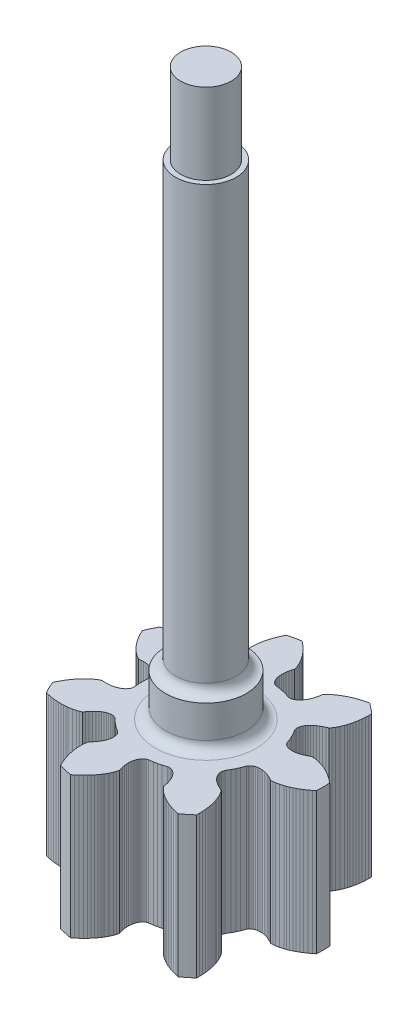
from build123d import *

# Parameters (mm, degrees)
SKETCH1_R           = 2
BOSS_EXTRUDE1_DEPTH = 2.1
SKETCH2_R           = 1.5
BOSS_EXTRUDE3_DEPTH = 25.9
BOSS_EXTRUDE4_DEPTH = 7
FILLET1_R           = 0.5
CUT_EXTRUDE3_START  = -4
SKETCH5_R           = 1.5
SKETCH5_R_2         = 1.25
CUT_EXTRUDE3_DEPTH  = 4


with BuildPart() as part:
    # Sketch1 → Boss-Extrude1 (new body)
    with BuildSketch(Plane(origin=(0, 0, 0), x_dir=(1, 0, 0), z_dir=(0, 1, 0))):
        with Locations(Location((0, 0, 0), (0, 0, 270))):
            Circle(SKETCH1_R)
    extrude(amount=BOSS_EXTRUDE1_DEPTH)

    # Sketch2 → Boss-Extrude3 (add)
    with BuildSketch(Plane(origin=(0, 2.1, 0), x_dir=(1, 0, 0), z_dir=(0, 1, 0))):
        with Locations(Location((0, 0, 0), (0, 0, 90))):
            Circle(SKETCH2_R)
    extrude(amount=BOSS_EXTRUDE3_DEPTH)

    # Sketch4 → Boss-Extrude4 (add)
    with BuildSketch(Plane.XZ):
        with BuildLine():
            Line((-1.677656104, -5.457545802), (-1.740166904, -5.314388502))
            Line((-1.740166904, -5.314388502), (-1.793915704, -5.175673402))
            Line((-1.793915704, -5.175673402), (-1.839244704, -5.042342702))
            Line((-1.839244704, -5.042342702), (-1.876421604, -4.915999102))
            Line((-1.876421604, -4.915999102), (-1.907053904, -4.793237402))
            Line((-1.907053904, -4.793237402), (-1.931099704, -4.676009702))
            Line((-1.931099704, -4.676009702), (-1.948773704, -4.566830802))
            Line((-1.948773704, -4.566830802), (-1.961024804, -4.464035702))
            Line((-1.961024804, -4.464035702), (-1.971502404, -4.279785302))
            Line((-1.971502404, -4.279785302), (-1.967365804, -4.124635702))
            Line((-1.967365804, -4.124635702), (-1.953730504, -4.000928102))
            Line((-1.953730504, -4.000928102), (-1.930260404, -3.886700602))
            Line((-1.930260404, -3.886700602), (-1.859391804, -3.809735002))
            Line((-1.859391804, -3.809735002), (-1.778417204, -3.712510502))
            Line((-1.778417204, -3.712510502), (-1.708697804, -3.615493902))
            Line((-1.708697804, -3.615493902), (-1.650076104, -3.519450202))
            Line((-1.650076104, -3.519450202), (-1.602332404, -3.425130202))
            Line((-1.602332404, -3.425130202), (-1.565200104, -3.333258302))
            Line((-1.565200104, -3.333258302), (-1.538382904, -3.244569502))
            Line((-1.538382904, -3.244569502), (-1.521548504, -3.159737902))
            Line((-1.521548504, -3.159737902), (-1.514299404, -3.079451802))
            Line((-1.514299404, -3.079451802), (-1.516222204, -3.004347502))
            Line((-1.516222204, -3.004347502), (-1.526863004, -2.935043002))
            Line((-1.526863004, -2.935043002), (-1.545721204, -2.872129302))
            Line((-1.545721204, -2.872129302), (-1.572279104, -2.816160102))
            Line((-1.572279104, -2.816160102), (-1.605971904, -2.767662302))
            Line((-1.605971904, -2.767662302), (-1.657232504, -2.718290402))
            Line((-1.657232504, -2.718290402), (-1.844744204, -2.592775302))
            Line((-1.844744204, -2.592775302), (-1.984007204, -2.487817902))
            Line((-1.984007204, -2.487817902), (-2.117322004, -2.375401802))
            Line((-2.117322004, -2.375401802), (-2.281415504, -2.220521102))
            Line((-2.281415504, -2.220521102), (-2.340956004, -2.181532002))
            Line((-2.340956004, -2.181532002), (-2.395735304, -2.159475702))
            Line((-2.395735304, -2.159475702), (-2.456210904, -2.146038102))
            Line((-2.456210904, -2.146038102), (-2.521743604, -2.141652302))
            Line((-2.521743604, -2.141652302), (-2.591678304, -2.146699902))
            Line((-2.591678304, -2.146699902), (-2.665327304, -2.161537602))
            Line((-2.665327304, -2.161537602), (-2.741987504, -2.186470302))
            Line((-2.741987504, -2.186470302), (-2.820946104, -2.221759402))
            Line((-2.820946104, -2.221759402), (-2.901443904, -2.267639402))
            Line((-2.901443904, -2.267639402), (-2.982749704, -2.324284202))
            Line((-2.982749704, -2.324284202), (-3.064080904, -2.391819002))
            Line((-3.064080904, -2.391819002), (-3.144672004, -2.470342602))
            Line((-3.144672004, -2.470342602), (-3.223742204, -2.559902302))
            Line((-3.223742204, -2.559902302), (-3.300510504, -2.660481102))
            Line((-3.300510504, -2.660481102), (-3.359776704, -2.746699402))
            Line((-3.359776704, -2.746699402), (-3.465917704, -2.794999002))
            Line((-3.465917704, -2.794999002), (-3.583489604, -2.835820002))
            Line((-3.583489604, -2.835820002), (-3.733828804, -2.874377002))
            Line((-3.733828804, -2.874377002), (-3.915791104, -2.905161502))
            Line((-3.915791104, -2.905161502), (-4.018735004, -2.916091602))
            Line((-4.018735004, -2.916091602), (-4.129109504, -2.923155402))
            Line((-4.129109504, -2.923155402), (-4.248748704, -2.925798102))
            Line((-4.248748704, -2.925798102), (-4.375248804, -2.923250802))
            Line((-4.375248804, -2.923250802), (-4.506697404, -2.915120202))
            Line((-4.506697404, -2.915120202), (-4.646771904, -2.900596502))
            Line((-4.646771904, -2.900596502), (-4.793969404, -2.879062302))
            Line((-4.793969404, -2.879062302), (-4.947447304, -2.849974302))
            Line((-4.947447304, -2.849974302), (-5.090225304, -2.816749202))
            ThreePointArc((-5.090225304, -2.816749202), (-5.241476502, -2.524161997), (-5.375926806, -2.223483907))
            Line((-5.375926806, -2.223483907), (-5.312882596, -2.091140098))
            Line((-5.312882596, -2.091140098), (-5.239932596, -1.953010098))
            Line((-5.239932596, -1.953010098), (-5.164992596, -1.824500098))
            Line((-5.164992596, -1.824500098), (-5.089012596, -1.705930098))
            Line((-5.089012596, -1.705930098), (-5.013412596, -1.598090098))
            Line((-5.013412596, -1.598090098), (-4.936532596, -1.497600098))
            Line((-4.936532596, -1.497600098), (-4.859872596, -1.405710098))
            Line((-4.859872596, -1.405710098), (-4.785532596, -1.323820098))
            Line((-4.785532596, -1.323820098), (-4.712802596, -1.250150098))
            Line((-4.712802596, -1.250150098), (-4.575282596, -1.127080098))
            Line((-4.575282596, -1.127080098), (-4.451402596, -1.033580098))
            Line((-4.451402596, -1.033580098), (-4.346182596, -0.967110098))
            Line((-4.346182596, -0.967110098), (-4.242242596, -0.914240098))
            Line((-4.242242596, -0.914240098), (-4.137882596, -0.921660098))
            Line((-4.137882596, -0.921660098), (-4.011382596, -0.924350098))
            Line((-4.011382596, -0.924350098), (-3.892062596, -0.918370098))
            Line((-3.892062596, -0.918370098), (-3.780422596, -0.904320098))
            Line((-3.780422596, -0.904320098), (-3.676912596, -0.882840098))
            Line((-3.676912596, -0.882840098), (-3.581932596, -0.854590098))
            Line((-3.581932596, -0.854590098), (-3.495872596, -0.820260098))
            Line((-3.495872596, -0.820260098), (-3.419052596, -0.780530098))
            Line((-3.419052596, -0.780530098), (-3.351762596, -0.736140098))
            Line((-3.351762596, -0.736140098), (-3.294242596, -0.687810098))
            Line((-3.294242596, -0.687810098), (-3.246692596, -0.636280098))
            Line((-3.246692596, -0.636280098), (-3.209262596, -0.582310098))
            Line((-3.209262596, -0.582310098), (-3.182062596, -0.526650098))
            Line((-3.182062596, -0.526650098), (-3.165152596, -0.470070098))
            Line((-3.165152596, -0.470070098), (-3.158512596, -0.399210098))
            Line((-3.158512596, -0.399210098), (-3.177292596, -0.174350098))
            Line((-3.177292596, -0.174350098), (-3.182062596, -3.0098e-05))
            Line((-3.182062596, -3.0098e-05), (-3.177292596, 0.174289902))
            Line((-3.177292596, 0.174289902), (-3.158512596, 0.399149902))
            Line((-3.158512596, 0.399149902), (-3.165152596, 0.470009902))
            Line((-3.165152596, 0.470009902), (-3.182062596, 0.526589902))
            Line((-3.182062596, 0.526589902), (-3.209262596, 0.582249902))
            Line((-3.209262596, 0.582249902), (-3.246692596, 0.636219902))
            Line((-3.246692596, 0.636219902), (-3.294242596, 0.687749902))
            Line((-3.294242596, 0.687749902), (-3.351762596, 0.736079902))
            Line((-3.351762596, 0.736079902), (-3.419052596, 0.780469902))
            Line((-3.419052596, 0.780469902), (-3.495872596, 0.820199902))
            Line((-3.495872596, 0.820199902), (-3.581932596, 0.854529902))
            Line((-3.581932596, 0.854529902), (-3.676912596, 0.882779902))
            Line((-3.676912596, 0.882779902), (-3.780422596, 0.904259902))
            Line((-3.780422596, 0.904259902), (-3.892062596, 0.918309902))
            Line((-3.892062596, 0.918309902), (-4.011382596, 0.924289902))
            Line((-4.011382596, 0.924289902), (-4.137882596, 0.921599902))
            Line((-4.137882596, 0.921599902), (-4.242242596, 0.914179902))
            Line((-4.242242596, 0.914179902), (-4.346182596, 0.967049902))
            Line((-4.346182596, 0.967049902), (-4.451402596, 1.033519902))
            Line((-4.451402596, 1.033519902), (-4.575282596, 1.127019902))
            Line((-4.575282596, 1.127019902), (-4.712802596, 1.250089902))
            Line((-4.712802596, 1.250089902), (-4.785532596, 1.323759902))
            Line((-4.785532596, 1.323759902), (-4.859872596, 1.405649902))
            Line((-4.859872596, 1.405649902), (-4.936532596, 1.497539902))
            Line((-4.936532596, 1.497539902), (-5.013412596, 1.598029902))
            Line((-5.013412596, 1.598029902), (-5.089012596, 1.705869902))
            Line((-5.089012596, 1.705869902), (-5.164992596, 1.824439902))
            Line((-5.164992596, 1.824439902), (-5.239932596, 1.952949902))
            Line((-5.239932596, 1.952949902), (-5.312882596, 2.091079902))
            Line((-5.312882596, 2.091079902), (-5.375926796, 2.223423702))
            ThreePointArc((-5.375926796, 2.223423702), (-5.241476491, 2.524101771), (-5.090225294, 2.816688957))
            Line((-5.090225294, 2.816688957), (-4.947447286, 2.849914054))
            Line((-4.947447286, 2.849914054), (-4.793969386, 2.879002054))
            Line((-4.793969386, 2.879002054), (-4.646771886, 2.900536254))
            Line((-4.646771886, 2.900536254), (-4.506697386, 2.915059954))
            Line((-4.506697386, 2.915059954), (-4.375248786, 2.923190554))
            Line((-4.375248786, 2.923190554), (-4.248748686, 2.925737854))
            Line((-4.248748686, 2.925737854), (-4.129109486, 2.923095154))
            Line((-4.129109486, 2.923095154), (-4.018734986, 2.916031354))
            Line((-4.018734986, 2.916031354), (-3.915791086, 2.905101254))
            Line((-3.915791086, 2.905101254), (-3.733828786, 2.874316754))
            Line((-3.733828786, 2.874316754), (-3.583489586, 2.835759754))
            Line((-3.583489586, 2.835759754), (-3.465917686, 2.794938754))
            Line((-3.465917686, 2.794938754), (-3.359776686, 2.746639154))
            Line((-3.359776686, 2.746639154), (-3.300510486, 2.660420854))
            Line((-3.300510486, 2.660420854), (-3.223742186, 2.559842054))
            Line((-3.223742186, 2.559842054), (-3.144671986, 2.470282354))
            Line((-3.144671986, 2.470282354), (-3.064080886, 2.391758754))
            Line((-3.064080886, 2.391758754), (-2.982749686, 2.324223954))
            Line((-2.982749686, 2.324223954), (-2.901443886, 2.267579154))
            Line((-2.901443886, 2.267579154), (-2.820946086, 2.221699154))
            Line((-2.820946086, 2.221699154), (-2.741987486, 2.186410054))
            Line((-2.741987486, 2.186410054), (-2.665327286, 2.161477354))
            Line((-2.665327286, 2.161477354), (-2.591678286, 2.146639654))
            Line((-2.591678286, 2.146639654), (-2.521743586, 2.141592054))
            Line((-2.521743586, 2.141592054), (-2.456210886, 2.145977854))
            Line((-2.456210886, 2.145977854), (-2.395735286, 2.159415454))
            Line((-2.395735286, 2.159415454), (-2.340955986, 2.181471754))
            Line((-2.340955986, 2.181471754), (-2.281415486, 2.220460854))
            Line((-2.281415486, 2.220460854), (-2.117321986, 2.375341554))
            Line((-2.117321986, 2.375341554), (-1.984007186, 2.487757654))
            Line((-1.984007186, 2.487757654), (-1.844744186, 2.592715054))
            Line((-1.844744186, 2.592715054), (-1.657232486, 2.718230154))
            Line((-1.657232486, 2.718230154), (-1.605971886, 2.767602054))
            Line((-1.605971886, 2.767602054), (-1.572279086, 2.816099854))
            Line((-1.572279086, 2.816099854), (-1.545721186, 2.872069054))
            Line((-1.545721186, 2.872069054), (-1.526862986, 2.934982754))
            Line((-1.526862986, 2.934982754), (-1.516222186, 3.004287254))
            Line((-1.516222186, 3.004287254), (-1.514299386, 3.079391554))
            Line((-1.514299386, 3.079391554), (-1.521548486, 3.159677654))
            Line((-1.521548486, 3.159677654), (-1.538382886, 3.244509254))
            Line((-1.538382886, 3.244509254), (-1.565200086, 3.333198054))
            Line((-1.565200086, 3.333198054), (-1.602332386, 3.425069954))
            Line((-1.602332386, 3.425069954), (-1.650076086, 3.519389954))
            Line((-1.650076086, 3.519389954), (-1.708697786, 3.615433654))
            Line((-1.708697786, 3.615433654), (-1.778417186, 3.712450254))
            Line((-1.778417186, 3.712450254), (-1.859391786, 3.809674754))
            Line((-1.859391786, 3.809674754), (-1.930260386, 3.886640354))
            Line((-1.930260386, 3.886640354), (-1.953730486, 4.000867854))
            Line((-1.953730486, 4.000867854), (-1.967365786, 4.124575454))
            Line((-1.967365786, 4.124575454), (-1.971502386, 4.279725054))
            Line((-1.971502386, 4.279725054), (-1.961024786, 4.463975454))
            Line((-1.961024786, 4.463975454), (-1.948773686, 4.566770554))
            Line((-1.948773686, 4.566770554), (-1.931099686, 4.675949454))
            Line((-1.931099686, 4.675949454), (-1.907053886, 4.793177154))
            Line((-1.907053886, 4.793177154), (-1.876421586, 4.915938854))
            Line((-1.876421586, 4.915938854), (-1.839244686, 5.042282454))
            Line((-1.839244686, 5.042282454), (-1.793915686, 5.175613154))
            Line((-1.793915686, 5.175613154), (-1.740166886, 5.314328254))
            Line((-1.740166886, 5.314328254), (-1.677656086, 5.457485554))
            Line((-1.677656086, 5.457485554), (-1.613492886, 5.589290554))
            ThreePointArc((-1.613492886, 5.589290554), (-1.294584924, 5.671642777), (-0.971527485, 5.735814951))
            Line((-0.971527485, 5.735814951), (-0.856530379, 5.644902123))
            Line((-0.856530379, 5.644902123), (-0.738096579, 5.543044323))
            Line((-0.738096579, 5.543044323), (-0.629484279, 5.441387023))
            Line((-0.629484279, 5.441387023), (-0.530794179, 5.340927723))
            Line((-0.530794179, 5.340927723), (-0.442480579, 5.243226523))
            Line((-0.442480579, 5.243226523), (-0.361617479, 5.145912923))
            Line((-0.361617479, 5.145912923), (-0.289089779, 5.050727423))
            Line((-0.289089779, 5.050727423), (-0.225795179, 4.960029123))
            Line((-0.225795179, 4.960029123), (-0.170156179, 4.872729423))
            Line((-0.170156179, 4.872729423), (-0.080772879, 4.711271723))
            Line((-0.080772879, 4.711271723), (-0.017182979, 4.569691923))
            Line((-0.017182979, 4.569691923), (0.024206821, 4.452319023))
            Line((0.024206821, 4.452319023), (0.052622421, 4.339220423))
            Line((0.052622421, 4.339220423), (0.022166221, 4.239128023))
            Line((0.022166221, 4.239128023), (-0.008605279, 4.116398223))
            Line((-0.008605279, 4.116398223), (-0.029326379, 3.998739123))
            Line((-0.029326379, 3.998739123), (-0.040470879, 3.886771723))
            Line((-0.040470879, 3.886771723), (-0.042562579, 3.781077223))
            Line((-0.042562579, 3.781077223), (-0.036155879, 3.682192323))
            Line((-0.036155879, 3.682192323), (-0.021836779, 3.590650923))
            Line((-0.021836779, 3.590650923), (-0.000196979, 3.506916223))
            Line((-0.000196979, 3.506916223), (0.028106621, 3.431435623))
            Line((0.028106621, 3.431435623), (0.062425521, 3.364603323))
            Line((0.062425521, 3.364603323), (0.102082621, 3.306779023))
            Line((0.102082621, 3.306779023), (0.146370621, 3.258277923))
            Line((0.146370621, 3.258277923), (0.194582521, 3.219374423))
            Line((0.194582521, 3.219374423), (0.245981121, 3.190298123))
            Line((0.245981121, 3.190298123), (0.313586921, 3.168056823))
            Line((0.313586921, 3.168056823), (0.536988121, 3.136329923))
            Line((0.536988121, 3.136329923), (0.707999021, 3.102190423))
            Line((0.707999021, 3.102190423), (0.876887021, 3.058750223))
            Line((0.876887021, 3.058750223), (1.091930421, 2.990405023))
            Line((1.091930421, 2.990405023), (1.162491321, 2.981110623))
            Line((1.162491321, 2.981110623), (1.221415521, 2.985006423))
            Line((1.221415521, 2.985006423), (1.281732621, 2.999139023))
            Line((1.281732621, 2.999139023), (1.342678421, 3.023621123))
            Line((1.342678421, 3.023621123), (1.403497321, 3.058512423))
            Line((1.403497321, 3.058512423), (1.463415021, 3.103835823))
            Line((1.463415021, 3.103835823), (1.521665521, 3.159561023))
            Line((1.521665521, 3.159561023), (1.577493421, 3.225614223))
            Line((1.577493421, 3.225614223), (1.630112821, 3.301877423))
            Line((1.630112821, 3.301877423), (1.678789621, 3.388189823))
            Line((1.678789621, 3.388189823), (1.722764221, 3.484324823))
            Line((1.722764221, 3.484324823), (1.761304221, 3.590039423))
            Line((1.761304221, 3.590039423), (1.793685421, 3.705037123))
            Line((1.793685421, 3.705037123), (1.819211821, 3.828964023))
            Line((1.819211821, 3.828964023), (1.835200121, 3.932358623))
            Line((1.835200121, 3.932358623), (1.909873421, 4.021928023))
            Line((1.909873421, 4.021928023), (1.998090521, 4.109718923))
            Line((1.998090521, 4.109718923), (2.116812121, 4.209687323))
            Line((2.116812121, 4.209687323), (2.267397621, 4.316373723))
            Line((2.267397621, 4.316373723), (2.355404521, 4.370887123))
            Line((2.355404521, 4.370887123), (2.451783521, 4.425141023))
            Line((2.451783521, 4.425141023), (2.558428121, 4.479431523))
            Line((2.558428121, 4.479431523), (2.673506021, 4.532022823))
            Line((2.673506021, 4.532022823), (2.795464821, 4.581730723))
            Line((2.795464821, 4.581730723), (2.927969221, 4.629421523))
            Line((2.927969221, 4.629421523), (3.069932921, 4.673886423))
            Line((3.069932921, 4.673886423), (3.220832621, 4.714270623))
            Line((3.220832621, 4.714270623), (3.363886921, 4.746284823))
            ThreePointArc((3.363886921, 4.746284823), (3.627108363, 4.548298309), (3.878703226, 4.335732528))
            Line((3.878703226, 4.335732528), (3.879324236, 4.189141042))
            Line((3.879324236, 4.189141042), (3.873530936, 4.033038442))
            Line((3.873530936, 4.033038442), (3.861770736, 3.884739642))
            Line((3.861770736, 3.884739642), (3.844760636, 3.744945242))
            Line((3.844760636, 3.744945242), (3.823437436, 3.614983242))
            Line((3.823437436, 3.614983242), (3.797771936, 3.491087842))
            Line((3.797771936, 3.491087842), (3.768573236, 3.375036342))
            Line((3.768573236, 3.375036342), (3.737125936, 3.269001042))
            Line((3.737125936, 3.269001042), (3.703562736, 3.171070342))
            Line((3.703562736, 3.171070342), (3.633059536, 3.000520342))
            Line((3.633059536, 3.000520342), (3.562015636, 2.862530242))
            Line((3.562015636, 2.862530242), (3.496055936, 2.756989642))
            Line((3.496055936, 2.756989642), (3.425348736, 2.664257542))
            Line((3.425348736, 2.664257542), (3.328104136, 2.625662642))
            Line((3.328104136, 2.625662642), (3.212964436, 2.573199942))
            Line((3.212964436, 2.573199942), (3.108055436, 2.516041142))
            Line((3.108055436, 2.516041142), (3.013567336, 2.454943742))
            Line((3.013567336, 2.454943742), (2.929627936, 2.390679642))
            Line((2.929627936, 2.390679642), (2.856311136, 2.324016942))
            Line((2.856311136, 2.324016942), (2.793668936, 2.255746642))
            Line((2.793668936, 2.255746642), (2.741694736, 2.186620242))
            Line((2.741694736, 2.186620242), (2.700328636, 2.117430142))
            Line((2.700328636, 2.117430142), (2.669474536, 2.048929342))
            Line((2.669474536, 2.048929342), (2.648991436, 1.981871242))
            Line((2.648991436, 1.981871242), (2.638684936, 1.917005642))
            Line((2.638684936, 1.917005642), (2.638328536, 1.855056142))
            Line((2.638328536, 1.855056142), (2.647642236, 1.796742342))
            Line((2.647642236, 1.796742342), (2.672404836, 1.730018642))
            Line((2.672404836, 1.730018642), (2.786888136, 1.535575142))
            Line((2.786888136, 1.535575142), (2.866820336, 1.380587942))
            Line((2.866820336, 1.380587942), (2.938157336, 1.221461342))
            Line((2.938157336, 1.221461342), (3.018800236, 1.010721142))
            Line((3.018800236, 1.010721142), (3.055527736, 0.949759542))
            Line((3.055527736, 0.949759542), (3.095312236, 0.906119642))
            Line((3.095312236, 0.906119642), (3.143968536, 0.867773342))
            Line((3.143968536, 0.867773342), (3.201108536, 0.835388342))
            Line((3.201108536, 0.835388342), (3.266307636, 0.809592642))
            Line((3.266307636, 0.809592642), (3.339100936, 0.791005742))
            Line((3.339100936, 0.791005742), (3.418987236, 0.780207842))
            Line((3.418987236, 0.780207842), (3.505437836, 0.777743242))
            Line((3.505437836, 0.777743242), (3.597870436, 0.784153042))
            Line((3.597870436, 0.784153042), (3.695701736, 0.799910942))
            Line((3.695701736, 0.799910942), (3.798280836, 0.825469442))
            Line((3.798280836, 0.825469442), (3.904961036, 0.861249642))
            Line((3.904961036, 0.861249642), (4.015059336, 0.907632842))
            Line((4.015059336, 0.907632842), (4.127864736, 0.964942742))
            Line((4.127864736, 0.964942742), (4.218670436, 1.016908042))
            Line((4.218670436, 1.016908042), (4.335256536, 1.014371642))
            Line((4.335256536, 1.014371642), (4.458896736, 1.000137542))
            Line((4.458896736, 1.000137542), (4.611076836, 0.969646442))
            Line((4.611076836, 0.969646442), (4.788376236, 0.918431942))
            Line((4.788376236, 0.918431942), (4.885867836, 0.883613842))
            Line((4.885867836, 0.883613842), (4.988376636, 0.842088442))
            Line((4.988376636, 0.842088442), (5.097314536, 0.792559942))
            Line((5.097314536, 0.792559942), (5.210181936, 0.735378542))
            Line((5.210181936, 0.735378542), (5.325085236, 0.671019742))
            Line((5.325085236, 0.671019742), (5.444986436, 0.597158342))
            Line((5.444986436, 0.597158342), (5.568263436, 0.513890042))
            Line((5.568263436, 0.513890042), (5.693921436, 0.421091042))
            Line((5.693921436, 0.421091042), (5.808144136, 0.329207242))
            ThreePointArc((5.808144136, 0.329207242), (5.817467929, -3.016e-05), (5.808144136, -0.329267562))
            Line((5.808144136, -0.329267562), (5.693921429, -0.421151358))
            Line((5.693921429, -0.421151358), (5.568263429, -0.513950358))
            Line((5.568263429, -0.513950358), (5.444986429, -0.597218658))
            Line((5.444986429, -0.597218658), (5.325085229, -0.671080058))
            Line((5.325085229, -0.671080058), (5.210181929, -0.735438858))
            Line((5.210181929, -0.735438858), (5.097314529, -0.792620258))
            Line((5.097314529, -0.792620258), (4.988376629, -0.842148758))
            Line((4.988376629, -0.842148758), (4.885867829, -0.883674158))
            Line((4.885867829, -0.883674158), (4.788376229, -0.918492258))
            Line((4.788376229, -0.918492258), (4.611076829, -0.969706758))
            Line((4.611076829, -0.969706758), (4.458896729, -1.000197858))
            Line((4.458896729, -1.000197858), (4.335256529, -1.014431958))
            Line((4.335256529, -1.014431958), (4.218670429, -1.016968358))
            Line((4.218670429, -1.016968358), (4.127864729, -0.965003058))
            Line((4.127864729, -0.965003058), (4.015059329, -0.907693158))
            Line((4.015059329, -0.907693158), (3.904961029, -0.861309958))
            Line((3.904961029, -0.861309958), (3.798280829, -0.825529758))
            Line((3.798280829, -0.825529758), (3.695701729, -0.799971258))
            Line((3.695701729, -0.799971258), (3.597870429, -0.784213358))
            Line((3.597870429, -0.784213358), (3.505437829, -0.777803558))
            Line((3.505437829, -0.777803558), (3.418987229, -0.780268158))
            Line((3.418987229, -0.780268158), (3.339100929, -0.791066058))
            Line((3.339100929, -0.791066058), (3.266307629, -0.809652958))
            Line((3.266307629, -0.809652958), (3.201108529, -0.835448658))
            Line((3.201108529, -0.835448658), (3.143968529, -0.867833658))
            Line((3.143968529, -0.867833658), (3.095312229, -0.906179958))
            Line((3.095312229, -0.906179958), (3.055527729, -0.949819858))
            Line((3.055527729, -0.949819858), (3.018800229, -1.010781458))
            Line((3.018800229, -1.010781458), (2.938157329, -1.221521658))
            Line((2.938157329, -1.221521658), (2.866820329, -1.380648258))
            Line((2.866820329, -1.380648258), (2.786888129, -1.535635458))
            Line((2.786888129, -1.535635458), (2.672404829, -1.730078958))
            Line((2.672404829, -1.730078958), (2.647642229, -1.796802658))
            Line((2.647642229, -1.796802658), (2.638328529, -1.855116458))
            Line((2.638328529, -1.855116458), (2.638684929, -1.917065958))
            Line((2.638684929, -1.917065958), (2.648991429, -1.981931558))
            Line((2.648991429, -1.981931558), (2.669474529, -2.048989658))
            Line((2.669474529, -2.048989658), (2.700328629, -2.117490458))
            Line((2.700328629, -2.117490458), (2.741694729, -2.186680558))
            Line((2.741694729, -2.186680558), (2.793668929, -2.255806958))
            Line((2.793668929, -2.255806958), (2.856311129, -2.324077258))
            Line((2.856311129, -2.324077258), (2.929627929, -2.390739958))
            Line((2.929627929, -2.390739958), (3.013567329, -2.455004058))
            Line((3.013567329, -2.455004058), (3.108055429, -2.516101458))
            Line((3.108055429, -2.516101458), (3.212964429, -2.573260258))
            Line((3.212964429, -2.573260258), (3.328104129, -2.625722958))
            Line((3.328104129, -2.625722958), (3.425348729, -2.664317858))
            Line((3.425348729, -2.664317858), (3.496055929, -2.757049958))
            Line((3.496055929, -2.757049958), (3.562015629, -2.862590558))
            Line((3.562015629, -2.862590558), (3.633059529, -3.000580658))
            Line((3.633059529, -3.000580658), (3.703562729, -3.171130658))
            Line((3.703562729, -3.171130658), (3.737125929, -3.269061358))
            Line((3.737125929, -3.269061358), (3.768573229, -3.375096658))
            Line((3.768573229, -3.375096658), (3.797771929, -3.491148158))
            Line((3.797771929, -3.491148158), (3.823437429, -3.615043558))
            Line((3.823437429, -3.615043558), (3.844760629, -3.745005558))
            Line((3.844760629, -3.745005558), (3.861770729, -3.884799958))
            Line((3.861770729, -3.884799958), (3.873530929, -4.033098758))
            Line((3.873530929, -4.033098758), (3.879324229, -4.189201358))
            Line((3.879324229, -4.189201358), (3.878703229, -4.335792858))
            ThreePointArc((3.878703229, -4.335792858), (3.627108367, -4.548358644), (3.363886927, -4.746345161))
            Line((3.363886927, -4.746345161), (3.220832594, -4.714330914))
            Line((3.220832594, -4.714330914), (3.069932894, -4.673946714))
            Line((3.069932894, -4.673946714), (2.927969194, -4.629481814))
            Line((2.927969194, -4.629481814), (2.795464794, -4.581791014))
            Line((2.795464794, -4.581791014), (2.673505994, -4.532083114))
            Line((2.673505994, -4.532083114), (2.558428094, -4.479491814))
            Line((2.558428094, -4.479491814), (2.451783494, -4.425201314))
            Line((2.451783494, -4.425201314), (2.355404494, -4.370947414))
            Line((2.355404494, -4.370947414), (2.267397594, -4.316434014))
            Line((2.267397594, -4.316434014), (2.116812094, -4.209747614))
            Line((2.116812094, -4.209747614), (1.998090494, -4.109779214))
            Line((1.998090494, -4.109779214), (1.909873394, -4.021988314))
            Line((1.909873394, -4.021988314), (1.835200094, -3.932418914))
            Line((1.835200094, -3.932418914), (1.819211794, -3.829024314))
            Line((1.819211794, -3.829024314), (1.793685394, -3.705097414))
            Line((1.793685394, -3.705097414), (1.761304194, -3.590099714))
            Line((1.761304194, -3.590099714), (1.722764194, -3.484385114))
            Line((1.722764194, -3.484385114), (1.678789594, -3.388250114))
            Line((1.678789594, -3.388250114), (1.630112794, -3.301937714))
            Line((1.630112794, -3.301937714), (1.577493394, -3.225674514))
            Line((1.577493394, -3.225674514), (1.521665494, -3.159621314))
            Line((1.521665494, -3.159621314), (1.463414994, -3.103896114))
            Line((1.463414994, -3.103896114), (1.403497294, -3.058572714))
            Line((1.403497294, -3.058572714), (1.342678394, -3.023681414))
            Line((1.342678394, -3.023681414), (1.281732594, -2.999199314))
            Line((1.281732594, -2.999199314), (1.221415494, -2.985066714))
            Line((1.221415494, -2.985066714), (1.162491294, -2.981170914))
            Line((1.162491294, -2.981170914), (1.091930394, -2.990465314))
            Line((1.091930394, -2.990465314), (0.876886994, -3.058810514))
            Line((0.876886994, -3.058810514), (0.707998994, -3.102250714))
            Line((0.707998994, -3.102250714), (0.536988094, -3.136390214))
            Line((0.536988094, -3.136390214), (0.313586894, -3.168117114))
            Line((0.313586894, -3.168117114), (0.245981094, -3.190358414))
            Line((0.245981094, -3.190358414), (0.194582494, -3.219434714))
            Line((0.194582494, -3.219434714), (0.146370594, -3.258338214))
            Line((0.146370594, -3.258338214), (0.102082594, -3.306839314))
            Line((0.102082594, -3.306839314), (0.062425494, -3.364663614))
            Line((0.062425494, -3.364663614), (0.028106594, -3.431495914))
            Line((0.028106594, -3.431495914), (-0.000197006, -3.506976514))
            Line((-0.000197006, -3.506976514), (-0.021836806, -3.590711214))
            Line((-0.021836806, -3.590711214), (-0.036155906, -3.682252614))
            Line((-0.036155906, -3.682252614), (-0.042562606, -3.781137514))
            Line((-0.042562606, -3.781137514), (-0.040470906, -3.886832014))
            Line((-0.040470906, -3.886832014), (-0.029326406, -3.998799414))
            Line((-0.029326406, -3.998799414), (-0.008605306, -4.116458514))
            Line((-0.008605306, -4.116458514), (0.022166194, -4.239188314))
            Line((0.022166194, -4.239188314), (0.052622394, -4.339280714))
            Line((0.052622394, -4.339280714), (0.024206794, -4.452379314))
            Line((0.024206794, -4.452379314), (-0.017183006, -4.569752214))
            Line((-0.017183006, -4.569752214), (-0.080772906, -4.711332014))
            Line((-0.080772906, -4.711332014), (-0.170156206, -4.872789714))
            Line((-0.170156206, -4.872789714), (-0.225795206, -4.960089414))
            Line((-0.225795206, -4.960089414), (-0.289089806, -5.050787714))
            Line((-0.289089806, -5.050787714), (-0.361617506, -5.145973214))
            Line((-0.361617506, -5.145973214), (-0.442480606, -5.243286814))
            Line((-0.442480606, -5.243286814), (-0.530794206, -5.340988014))
            Line((-0.530794206, -5.340988014), (-0.629484306, -5.441447314))
            Line((-0.629484306, -5.441447314), (-0.738096606, -5.543104614))
            Line((-0.738096606, -5.543104614), (-0.856530406, -5.644962414))
            Line((-0.856530406, -5.644962414), (-0.971527506, -5.735875214))
            ThreePointArc((-0.971527506, -5.735875214), (-1.294584942, -5.671703035), (-1.613492901, -5.589350807))
            Line((-1.613492901, -5.589350807), (-1.677656104, -5.457545802))
        make_face()
    extrude(amount=BOSS_EXTRUDE4_DEPTH)

    # Fillet1
    fillet1_edges = [part.edges().sort_by_distance(p)[0] for p in [
        (0, 0, -2),
        (0, 2.1, 1.5),
    ]]
    fillet(fillet1_edges, radius=FILLET1_R - 0.0001)  # a hair under: the kernel refuses the full size

    # Sketch5 → Cut-Extrude3 (cut)
    with BuildSketch(Plane(origin=(0, 28, 0), x_dir=(1, 0, 0), z_dir=(0, 1, 0)).offset(CUT_EXTRUDE3_START)):
        with Locations(Location((0, 0, 0), (0, 0, 90))):
            Circle(SKETCH5_R)
        with Locations(Location((0, 0, 0), (0, 0, 270))):
            Circle(SKETCH5_R_2, mode=Mode.SUBTRACT)
    extrude(amount=CUT_EXTRUDE3_DEPTH, mode=Mode.SUBTRACT)


solid = part.part
